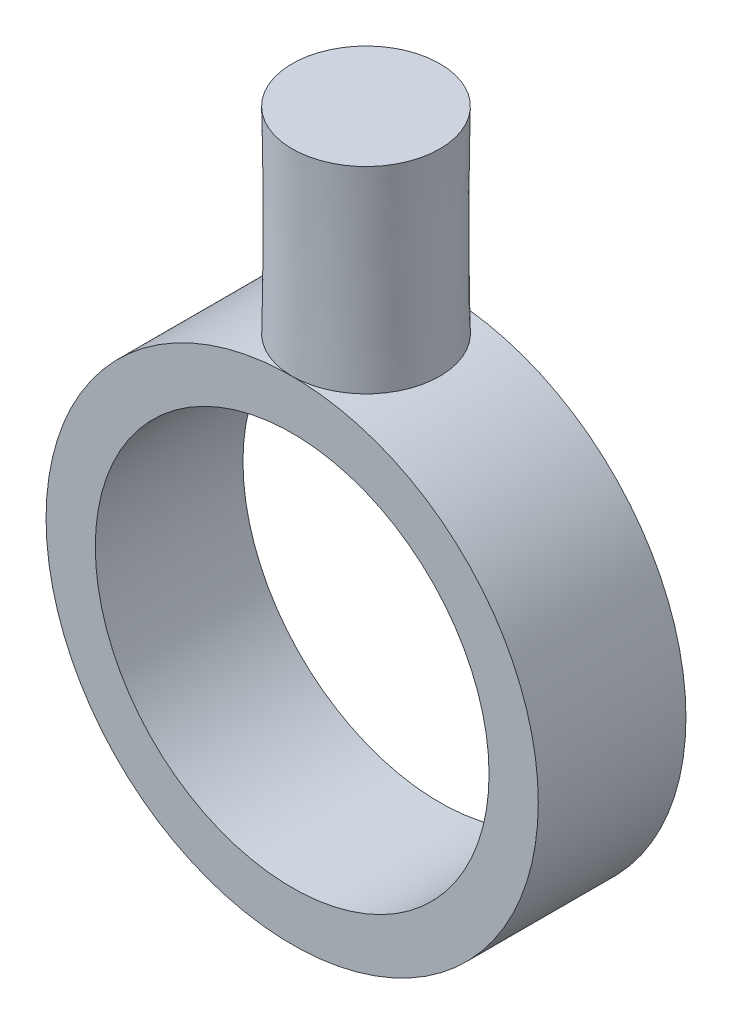
from build123d import *

# Parameters (mm, degrees)
SKETCH1_R           = 50
SKETCH1_R_2         = 40
BOSS_EXTRUDE1_DEPTH = 30


with BuildPart() as part:
    # Sketch1 → Boss-Extrude1 (new body)
    with BuildSketch(Plane.XY):
        Circle(SKETCH1_R)
        Circle(SKETCH1_R_2, mode=Mode.SUBTRACT)
    extrude(amount=BOSS_EXTRUDE1_DEPTH)


with BuildPart() as body_2:
    # Loft1: read off the stored shape, not the designer's step
    # Loft1: loft between two sections, ruled curve by curve
    loft1_from = [
        Edge.make_bspline([(8.368784012, 90, 2.551568205), (33.265647603, 90, 19.289136228), (16.528079579, 90, 44.185999819), (-8.368784012, 90, 27.448431795), (-33.265647603, 90, 10.710863772), (-16.528079579, 90, -14.185999819), (8.368784012, 90, 2.551568205)], [0, 0, 0, 0, 0.5, 0.5, 0.5, 1, 1, 1, 1], 3, [1, 0.333333333, 0.333333333, 1, 0.333333333, 0.333333333, 1]),
    ]
    loft1_to = [
        Edge.make_bspline([(12.017867278, 50, 6.023872434), (29.97012241, 50, 30.059606991), (5.934387853, 50, 48.011862123), (-12.017867278, 50, 23.976127566), (-29.97012241, 50, -0.059606991), (-5.934387853, 50, -18.011862123), (12.017867278, 50, 6.023872434)], [0, 0, 0, 0, 0.5, 0.5, 0.5, 1, 1, 1, 1], 3, [1, 0.333333333, 0.333333333, 1, 0.333333333, 0.333333333, 1]),
    ]
    loft1 = Solid(Shell([*[Face.make_surface_from_curves(loft1_from[k], loft1_to[k]) for k in range(1)], Face(Wire(loft1_from)), Face(Wire(loft1_to))]))
    add(loft1)


solid = Compound([part.part, body_2.part])
